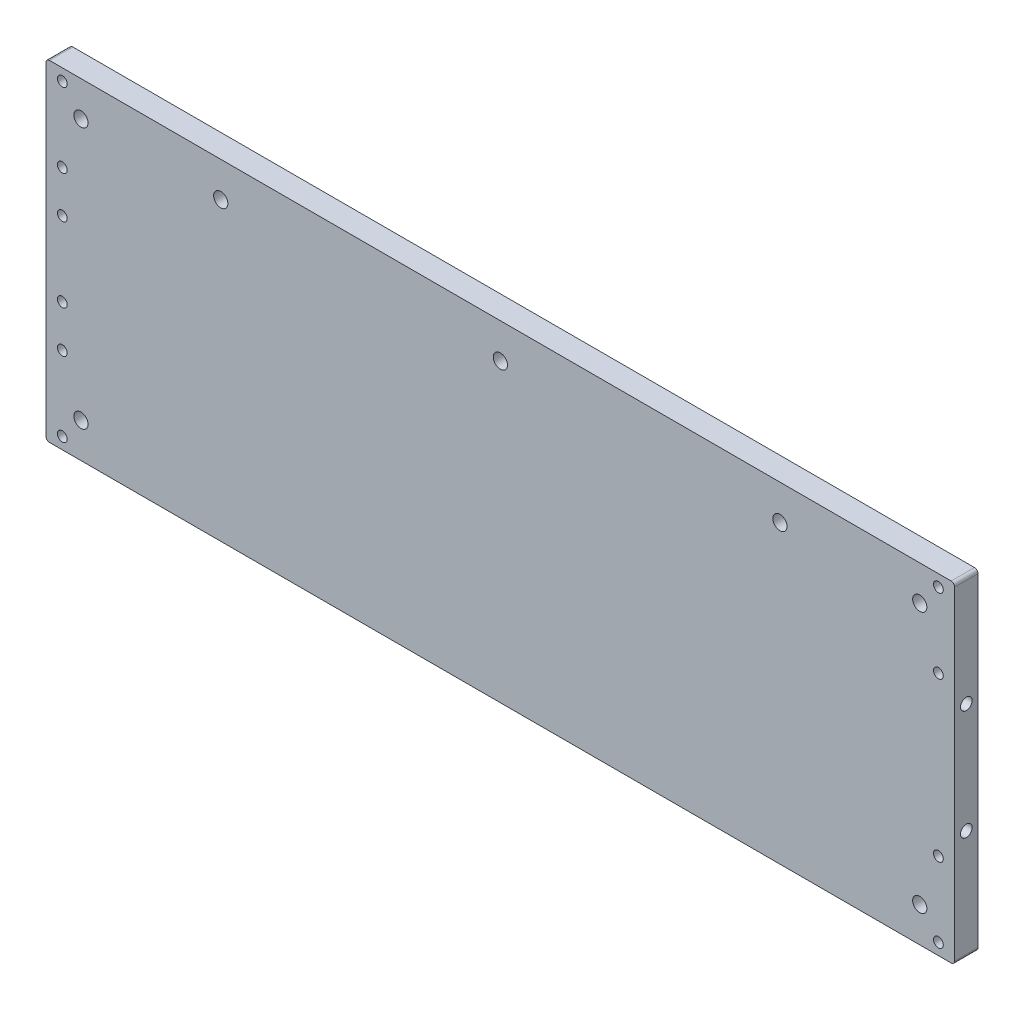
from build123d import *

# Parameters (mm, degrees)
SKETCH1_W           = 390
SKETCH1_H           = 142
BOSS_EXTRUDE1_DEPTH = 5
SKETCH2_R           = 2.1
CUT_EXTRUDE1_DEPTH  = 208.764289521
SKETCH3_R           = 3.05
CUT_EXTRUDE2_DEPTH  = 208.764289521
SKETCH5_R           = 2.5
CUT_EXTRUDE4_DEPTH  = 10
SKETCH6_R           = 2.1
CUT_EXTRUDE5_DEPTH  = 208.764289521
FILLET1_R           = 1.5


with BuildPart() as part:
    # Sketch1 → Boss-Extrude1 (new, symmetric)
    with BuildSketch(Plane.XY):
        Rectangle(SKETCH1_W, SKETCH1_H)
    extrude(amount=BOSS_EXTRUDE1_DEPTH, both=True)

    # Sketch2 → Cut-Extrude1 (cut, through all)
    with BuildSketch(Plane(origin=(0, 0, -5), x_dir=(-1, 0, 0), z_dir=(0, 0, -1))):
        with Locations((-188, 66)):
            Circle(SKETCH2_R)
        with Locations((-188, -66)):
            Circle(SKETCH2_R)
        with Locations((188, 66)):
            Circle(SKETCH2_R)
        with Locations((188, -66)):
            Circle(SKETCH2_R)
        with Locations((-188, 34)):
            Circle(SKETCH2_R)
        with Locations((-188, -34)):
            Circle(SKETCH2_R)
        with Locations((188, 34)):
            Circle(SKETCH2_R)
        with Locations((188, -34)):
            Circle(SKETCH2_R)
    extrude(amount=-CUT_EXTRUDE1_DEPTH, mode=Mode.SUBTRACT)

    # Sketch3 → Cut-Extrude2 (cut, through all)
    with BuildSketch(Plane.XY.offset(5)):
        with Locations((-180, 56)):
            Circle(SKETCH3_R)
        with Locations((180, 56)):
            Circle(SKETCH3_R)
        with Locations((180, -56)):
            Circle(SKETCH3_R)
        with Locations((-180, -56)):
            Circle(SKETCH3_R)
        with Locations((0, 56)):
            Circle(SKETCH3_R)
        with Locations((-120, 56)):
            Circle(SKETCH3_R)
        with Locations((120, 56)):
            Circle(SKETCH3_R)
    extrude(amount=-CUT_EXTRUDE2_DEPTH, mode=Mode.SUBTRACT)

    # Sketch5 → Cut-Extrude4 (cut)
    with BuildSketch(Plane(origin=(195, 0, 0), x_dir=(0, 0, -1), z_dir=(1, 0, 0))):
        with Locations((0, 23.6)):
            Circle(SKETCH5_R)
        with Locations((0, -23.6)):
            Circle(SKETCH5_R)
    extrude(amount=-CUT_EXTRUDE4_DEPTH, mode=Mode.SUBTRACT)

    # Sketch6 → Cut-Extrude5 (cut, through all)
    with BuildSketch(Plane.XY.offset(5)):
        with Locations((-188, 16)):
            Circle(SKETCH6_R)
        with Locations((-188, -16)):
            Circle(SKETCH6_R)
    extrude(amount=-CUT_EXTRUDE5_DEPTH, mode=Mode.SUBTRACT)

    # Fillet1
    fillet1_edges = [part.edges().sort_by_distance(p)[0] for p in [
        (-195, -71, 0),
        (195, -71, 0),
        (195, 71, 0),
        (-195, 71, 0),
    ]]
    fillet(fillet1_edges, radius=FILLET1_R)


solid = part.part
